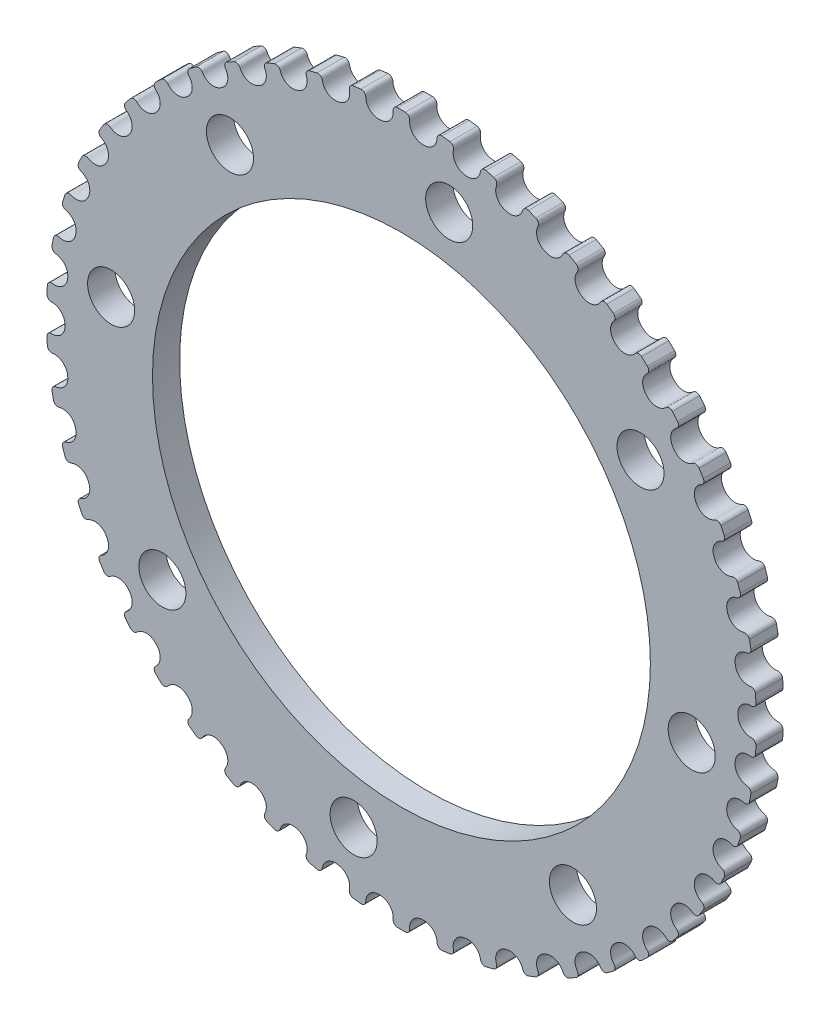
from build123d import *

# Parameters (mm, degrees)
SKETCHREVOLVEGEARBELT01_W       = 3
SKETCHREVOLVEGEARBELT01_H       = 39.217218411
TOOTHEXTRUDECUTGEARBELT01_DEPTH = 7.238999891
PATTERNGEARBELT01_COUNT         = 50
BOREREVOLVESKETCH_W             = 14.477999782
BOREREVOLVESKETCH_H             = 27.5
SKETCH1_R                       = 2.6
CUT_EXTRUDE1_DEPTH              = 10


with BuildPart() as part:
    # SketchRevolveGearBelt01 → GearBelt01 (revolve)
    with BuildSketch(Plane(origin=(0, 0, 0), x_dir=(0, 0, -1), z_dir=(1, 0, 0))):
        with Locations((0, 19.608609206)):
            Rectangle(SKETCHREVOLVEGEARBELT01_W, SKETCHREVOLVEGEARBELT01_H)
    revolve(axis=Axis((0, 0, 0), (0, 0, -1)))

    # SketchToothGearBelt01 → ToothExtrudeCutGearBelt01 (cut, symmetric)
    with BuildSketch(Plane.XY):
        with BuildLine():
            ThreePointArc((39.164679022, 2.032334243), (39.217374535, 0), (39.164679022, -2.032334243))
            add(Edge.make_bspline(
                [(39.164679022, -2.032334243), (39.166048883, -2.005984565), (39.164883295, -1.966294001), (39.156943231, -1.91408071), (39.147835553, -1.875531869), (39.135634795, -1.83784758), (39.12042125, -1.801275572), (39.102294908, -1.766056265), (39.081374934, -1.732421187), (39.057798852, -1.700591449), (39.031721649, -1.670776298), (39.003314752, -1.64317173), (38.972764904, -1.617959231), (38.940272938, -1.59530448), (38.906052449, -1.575356646), (38.870328405, -1.558245974), (38.833335623, -1.544088262), (38.795317397, -1.532964211), (38.756523252, -1.524993116), (38.717209712, -1.520055082), (38.66580266, -1.5184582), (38.589994052, -1.519756698), (38.489697952, -1.516042965), (38.377509936, -1.502613699), (38.266707897, -1.480535762), (38.157982142, -1.449806634), (38.052000418, -1.410652745), (37.949416183, -1.363305357), (37.850861265, -1.308058822), (37.756942857, -1.245252774), (37.668239537, -1.175274325), (37.585297771, -1.098554529), (37.50862852, -1.015566038), (37.43870413, -0.926820101), (37.375955295, -0.832863447), (37.320768875, -0.73427489), (37.27348376, -0.631661826), (37.234395318, -0.525656278), (37.203729181, -0.416911781), (37.181730901, -0.306096466), (37.168324647, -0.193899714), (37.165224472, -0.105119728), (37.165512565, -0.040500395), (37.16545238, 0), (37.165512565, 0.040500395), (37.165224472, 0.105119728), (37.168324647, 0.193899714), (37.181730901, 0.306096466), (37.203729181, 0.416911781), (37.234395318, 0.525656278), (37.27348376, 0.631661826), (37.320768875, 0.73427489), (37.375955295, 0.832863447), (37.43870413, 0.926820101), (37.50862852, 1.015566038), (37.585297771, 1.098554529), (37.668239537, 1.175274325), (37.756942857, 1.245252774), (37.850861265, 1.308058822), (37.949416183, 1.363305357), (38.052000418, 1.410652745), (38.157982142, 1.449806634), (38.266707897, 1.480535762), (38.377509936, 1.502613699), (38.489697952, 1.516042965), (38.589994052, 1.519756698), (38.66580266, 1.5184582), (38.717209712, 1.520055082), (38.756523252, 1.524993116), (38.795317397, 1.532964211), (38.833335623, 1.544088262), (38.870328405, 1.558245974), (38.906052449, 1.575356646), (38.940272938, 1.59530448), (38.972764904, 1.617959231), (39.003314752, 1.64317173), (39.031721649, 1.670776298), (39.057798852, 1.700591449), (39.081374934, 1.732421187), (39.102294908, 1.766056265), (39.12042125, 1.801275572), (39.135634795, 1.83784758), (39.147835553, 1.875531869), (39.156943231, 1.91408071), (39.164883295, 1.966294001), (39.166048883, 2.005984565), (39.164679022, 2.032334243)],
                knots=[0, 0, 0, 0, 0.012346399, 0.018519598, 0.024692797, 0.030865997, 0.037039196, 0.043212395, 0.049385595, 0.055558794, 0.061731993, 0.067905193, 0.074078392, 0.080251591, 0.086424791, 0.09259799, 0.09877119, 0.104944389, 0.111117588, 0.117290788, 0.123463987, 0.135171051, 0.152780618, 0.170390185, 0.187999752, 0.205609319, 0.223218886, 0.240828453, 0.25843802, 0.276047587, 0.293657154, 0.311266721, 0.328876288, 0.346485855, 0.364095422, 0.381704989, 0.399314555, 0.416924122, 0.434533689, 0.452143256, 0.469752823, 0.48736239, 0.493681195, 0.5, 0.506318805, 0.51263761, 0.530247177, 0.547856744, 0.565466311, 0.583075878, 0.600685445, 0.618295011, 0.635904578, 0.653514145, 0.671123712, 0.688733279, 0.706342846, 0.723952413, 0.74156198, 0.759171547, 0.776781114, 0.794390681, 0.812000248, 0.829609815, 0.847219382, 0.864828949, 0.876536013, 0.882709212, 0.888882412, 0.895055611, 0.90122881, 0.90740201, 0.913575209, 0.919748409, 0.925921608, 0.932094807, 0.938268007, 0.944441206, 0.950614405, 0.956787605, 0.962960804, 0.969134003, 0.975307203, 0.981480402, 0.987653601, 1, 1, 1, 1], degree=3))
        make_face()
    toothextrudecutgearbelt01 = extrude(amount=TOOTHEXTRUDECUTGEARBELT01_DEPTH, both=True, mode=Mode.SUBTRACT)

    # PatternGearBelt01: ToothExtrudeCutGearBelt01 ×50 about axis
    patterngearbelt01_axis = Axis((0, 0, 55), (0, 0, -1))
    for i in range(1, PATTERNGEARBELT01_COUNT):
        add(toothextrudecutgearbelt01.rotate(patterngearbelt01_axis, i * 360 / PATTERNGEARBELT01_COUNT), mode=Mode.SUBTRACT)

    # BoreRevolveSketch → BoreRevolveCut (revolve, cut)
    with BuildSketch(Plane(origin=(0, 0, 0), x_dir=(0, 0, -1), z_dir=(1, 0, 0))):
        with Locations((0, 13.75)):
            Rectangle(BOREREVOLVESKETCH_W, BOREREVOLVESKETCH_H)
    revolve(axis=Axis((0, 0, 0), (0, 0, -1)), mode=Mode.SUBTRACT)

    # Sketch1 → Cut-Extrude1 (cut)
    with BuildSketch(Plane.XY.offset(1.5)):
        with Locations((-18.943179255, 26.408444856)):
            Circle(SKETCH1_R)
        with Locations((5.27873993, 32.068440947)):
            Circle(SKETCH1_R)
        with Locations((26.408444856, 18.943179255)):
            Circle(SKETCH1_R)
        with Locations((-32.068440947, 5.27873993)):
            Circle(SKETCH1_R)
        with Locations((-26.408444856, -18.943179255)):
            Circle(SKETCH1_R)
        with Locations((-5.27873993, -32.068440947)):
            Circle(SKETCH1_R)
        with Locations((18.943179255, -26.408444856)):
            Circle(SKETCH1_R)
        with Locations((32.068440947, -5.27873993)):
            Circle(SKETCH1_R)
    extrude(amount=-CUT_EXTRUDE1_DEPTH, mode=Mode.SUBTRACT)


solid = part.part
